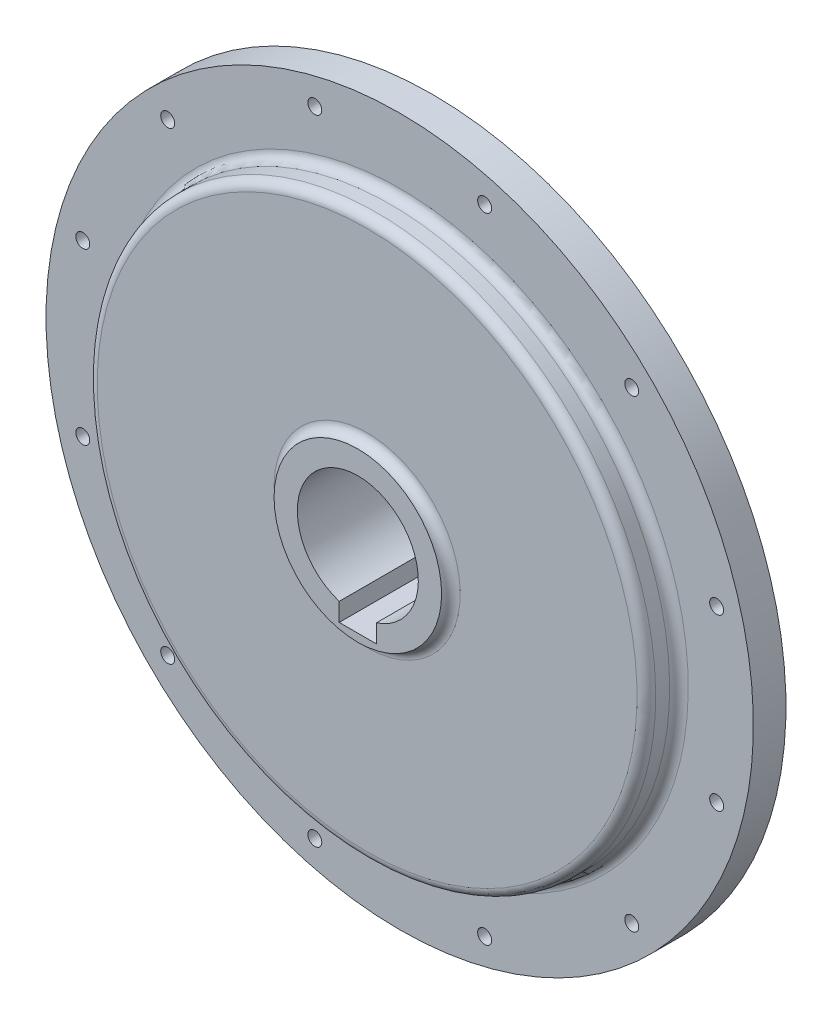
from build123d import *

# Parameters (mm, degrees)
FILLET1_R          = 2
SKETCH3_R          = 67
SKETCH3_R_2        = 65
CUT_EXTRUDE1_DEPTH = 3
SKETCH4_R          = 1.5
CUT_EXTRUDE3_DEPTH = 109.148046677
CIRPATTERN1_COUNT  = 12
SKETCH5_W          = 8
SKETCH5_H          = 7
CUT_EXTRUDE4_DEPTH = 110.512556358


with BuildPart() as part:
    # Sketch1 → Revolve1 (revolve)
    with BuildSketch(Plane(origin=(0, 0, 0), x_dir=(0, 0, -1), z_dir=(1, 0, 0))):
        Polygon((0, 13), (-21, 13), (-21, 18), (-19, 18), (-19, 60), (-12, 60), (-12, 76), (-5, 76), (-5, 63), (-3, 63), (-3, 50), (-7, 50), (-7, 18), (0, 18), align=None)
    revolve(axis=Axis((0, 0, 0), (0, 0, 1)))

    # Fillet1
    fillet1_edges = [part.edges().sort_by_distance(p)[0] for p in [
        (0, -50, 7),
        (0, -60, 12),
        (0, -60, 19),
        (0, -18, 19),
        (0, -18, 7),
    ]]
    fillet(fillet1_edges, radius=FILLET1_R - 0.0001)  # a hair under: the kernel refuses the full size

    # Sketch3 → Cut-Extrude1 (cut)
    with BuildSketch(Plane(origin=(0, 0, 5), x_dir=(-1, 0, 0), z_dir=(0, 0, -1))):
        with Locations(Location((0, 0, 0), (0, 0, 90))):
            Circle(SKETCH3_R)
        with Locations(Location((0, 0, 0), (0, 0, 90))):
            Circle(SKETCH3_R_2, mode=Mode.SUBTRACT)
    extrude(amount=-CUT_EXTRUDE1_DEPTH, mode=Mode.SUBTRACT)

    # Sketch4 → Cut-Extrude3 (cut, through all)
    with BuildSketch(Plane.XY.offset(12)):
        with Locations((18.24874767, 68.105253479)):
            Circle(SKETCH4_R)
    cut_extrude3 = extrude(amount=-CUT_EXTRUDE3_DEPTH, mode=Mode.SUBTRACT)

    # CirPattern1: Cut-Extrude3 ×12 about axis
    cirpattern1_axis = Axis((0, 0, 0), (0, 0, 1))
    for i in range(1, CIRPATTERN1_COUNT):
        add(cut_extrude3.rotate(cirpattern1_axis, i * 360 / CIRPATTERN1_COUNT), mode=Mode.SUBTRACT)

    # Sketch5 → Cut-Extrude4 (cut, through all)
    with BuildSketch(Plane.XY.offset(21)):
        with Locations((0, -12.8)):
            Rectangle(SKETCH5_W, SKETCH5_H)
    extrude(amount=-CUT_EXTRUDE4_DEPTH, mode=Mode.SUBTRACT)


solid = part.part
